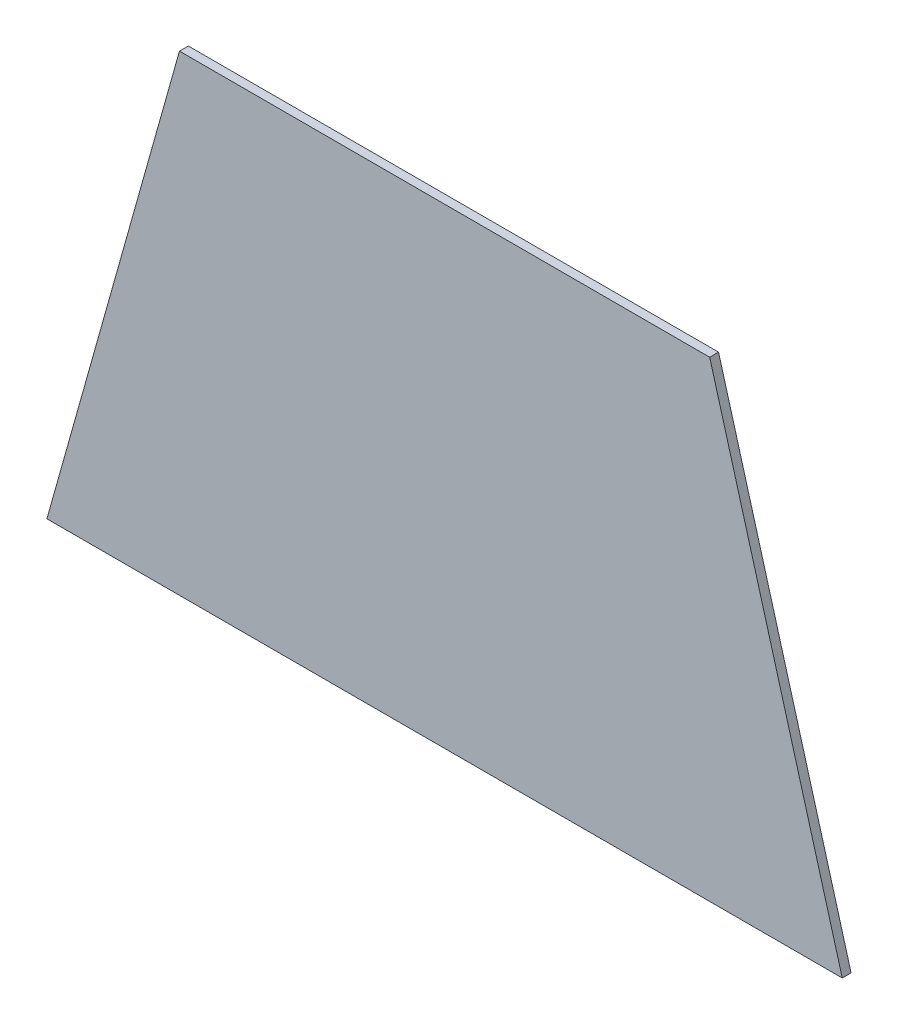
from build123d import *

# Parameters (mm, degrees)
BOSS_EXTRUDE1_DEPTH = 3


with BuildPart() as part:
    # Sketch1 → Boss-Extrude1 (new body)
    with BuildSketch(Plane.XY):
        Polygon((-135, -80), (135, -80), (90, 80), (-90, 80), align=None)
    extrude(amount=BOSS_EXTRUDE1_DEPTH)


solid = part.part
